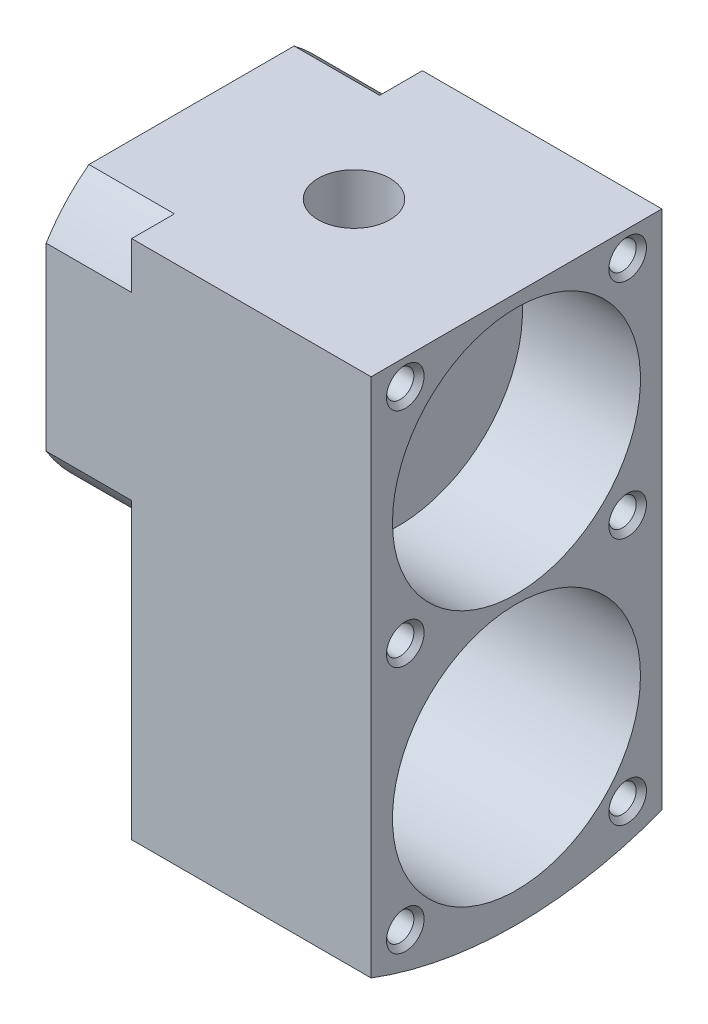
from build123d import *

# Parameters (mm, degrees)
SKETCH_3_R               = 7.25
CUT_EXTRUDE_1_DEPTH      = 12
CUT_EXTRUDE_3_DEPTH      = 39.897300678
CUT_EXTRUDE_2_DEPTH      = 16
CUT_EXTRUDE_2_DEPTH_BACK = 10
SKETCH_4_R               = 2.1
M2X0_41_D                = 1.6
M2X0_41_DEPTH            = 7
M2X0_41_CSINK_D          = 2.2
M2X0_41_CSINK_ANGLE      = 90
M2X0_41_TIP              = 0.480688495
SKETCH_12_R              = 7.25
SKETCH_12_R_2            = 5.25
CUT_EXTRUDE_4_DEPTH      = 0.8


# Read off the part's stored shape, not the designer's step: Отверстие обработанное метчиком M3x0.51
with BuildPart() as part:
    # Эскиз2 → Повернуть1 (revolve)
    with BuildSketch(Plane.XY, mode=Mode.PRIVATE) as revolve_1_sk:
        Polygon((0, 10), (5, 10), (5, 24), (19, 24), (19, 7.25), (12.1, 7.25), (12.1, 2.5), (6.9, 2.5), (6.9, 7.25), (0, 7.25), align=None)
    revolve(revolve_1_sk.sketch.rotate(Axis((0, 0, 0), (1, 0, 0)), 90), axis=Axis((0, 0, 0), (1, 0, 0)))

    # Эскиз3 → Вырез-Вытянуть1 (cut)
    with BuildSketch(Plane(origin=(19, 0, 0), x_dir=(0, 0, -1), z_dir=(1, 0, 0))):
        with Locations((0, -15)):
            Circle(SKETCH_3_R)
    extrude(amount=-CUT_EXTRUDE_1_DEPTH, mode=Mode.SUBTRACT)

    # Эскиз5 → Вырез-Вытянуть3 (cut, through all)
    with BuildSketch(Plane(origin=(19, 0, 0), x_dir=(0, 0, -1), z_dir=(1, 0, 0))):
        with BuildLine():
            ThreePointArc((24, 0), (-13.638181697, 19.748417658), (-8.5, -22.444375687))
            Line((-8.5, -22.444375687), (-8.5, 8))
            Line((-8.5, 8), (8.5, 8))
            Line((8.5, 8), (8.5, -22.444375687))
            ThreePointArc((8.5, -22.444375687), (19.748417658, -13.638181697), (24, 0))
        make_face()
    extrude(amount=-CUT_EXTRUDE_3_DEPTH, mode=Mode.SUBTRACT)

    # Эскиз4 → Вырез-Вытянуть2 (cut, two sides: drawn at the far end of the back side and taken through both)
    with BuildSketch(Plane(origin=(0, 0, 0), x_dir=(1, 0, 0), z_dir=(0, 1, 0)).offset(-CUT_EXTRUDE_2_DEPTH_BACK)):
        with Locations(Location((9.5, 0, 0), (0, 0, 90))):
            Circle(SKETCH_4_R)
    extrude(amount=CUT_EXTRUDE_2_DEPTH + CUT_EXTRUDE_2_DEPTH_BACK, mode=Mode.SUBTRACT)

    # Отверстие обработанное метчиком M3x0.51 outline → Отверстие обработанное метчиком M3x0.51 (revolve, cut)
    with BuildSketch(Plane(origin=(9.5, 4, 0), x_dir=(1, 0, 0), z_dir=(0, -1, 0))):
        Polygon((1.25, -8.1), (1.25, -1.687245944), (0, -1.687245944), (0, -8.5), (1.65, -8.5), align=None)
    revolve(axis=Axis((9.5, 4, 0), (0, 0, 1)), mode=Mode.SUBTRACT)

    # Отверстие обработанное метчиком M2x0.41
    with Locations(Plane(origin=(19, 0, 0), x_dir=(0, 0, -1), z_dir=(1, 0, 0))):
        with Locations((-6.5, 6.5), (6.5, 6.5), (6.5, -6.5), (-6.5, -6.5), (-6.5, -21), (6.5, -21)):
            CounterSinkHole(M2X0_41_D / 2, M2X0_41_CSINK_D / 2, depth=M2X0_41_DEPTH, counter_sink_angle=M2X0_41_CSINK_ANGLE)
            with Locations((0, 0, -(M2X0_41_DEPTH + M2X0_41_TIP / 2))):  # 118° drill point
                Cone(0, M2X0_41_D / 2, M2X0_41_TIP, mode=Mode.SUBTRACT)

    # Эскиз12 → Вырез-Вытянуть4 (cut)
    with BuildSketch(Plane(origin=(7, 0, 0), x_dir=(0, 0, -1), z_dir=(1, 0, 0))):
        with Locations((0, -15)):
            Circle(SKETCH_12_R)
        with Locations((0, -15)):
            Circle(SKETCH_12_R_2, mode=Mode.SUBTRACT)
    extrude(amount=-CUT_EXTRUDE_4_DEPTH, mode=Mode.SUBTRACT)

    # Эскиз13 → Отверстие обработанное метчиком M6x0.51 (revolve, cut)
    with BuildSketch(Plane(origin=(7, -15, 0), x_dir=(0, 0, -1), z_dir=(0, 1, 0))):
        Polygon((0, 0), (0, 2), (3.1, 2), (2.75, 1.65), (2.75, 0.35), (3.1, 0), align=None)
    revolve(axis=Axis((13.35, -15, 0), (-1, 0, 0)), mode=Mode.SUBTRACT)


solid = part.part
